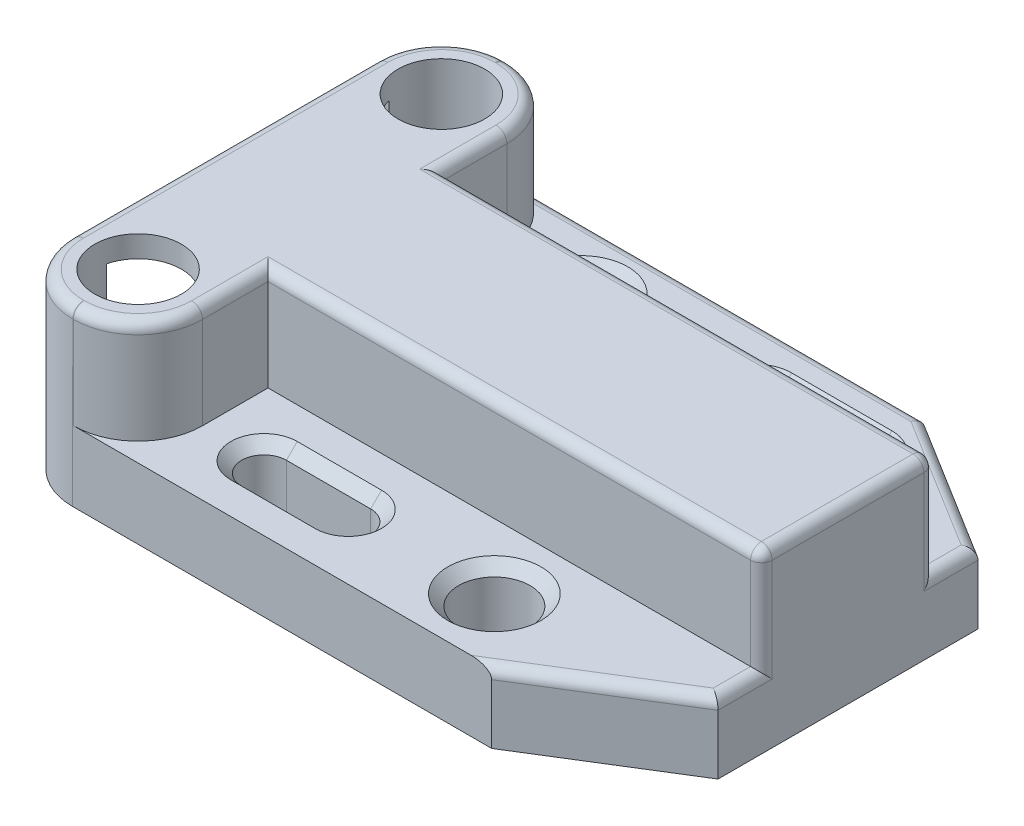
from build123d import *

# Parameters (mm, degrees)
BOSS_EXTRUDE1_DEPTH = 6.5
SKETCH2_R           = 4
CUT_EXTRUDE1_DEPTH  = 5.5
SKETCH2_3_R         = 4
BOSS_EXTRUDE2_DEPTH = 9.5
SKETCH3_R           = 3.3
CUT_EXTRUDE2_DEPTH  = 9.5
CHAMFER2_SIZE       = 1
FILLET4_R           = 1
FILLET11_R          = 1
SKETCH4_W           = 26.1
SKETCH4_H           = 12
CUT_EXTRUDE3_DEPTH  = 9.5
SKETCH6_W           = 14
SKETCH6_H           = 10
CUT_EXTRUDE4_DEPTH  = 20
SKETCH7_W           = 3
SKETCH7_H           = 1
CUT_EXTRUDE5_DEPTH  = 20


with BuildPart() as part:
    # Sketch1 → Boss-Extrude1 (new body)
    with BuildSketch(Plane(origin=(0, 0, 0), x_dir=(1, 0, 0), z_dir=(0, 1, 0))):
        with BuildLine():
            Line((33.105088062, -37.14381788), (46.001963062, -29.14381788))
            Line((46.001963062, -29.14381788), (46.001963062, -5.14381788))
            Line((46.001963062, -5.14381788), (33.105088062, 2.85618212))
            Line((33.105088062, 2.85618212), (-5.594911938, 2.85618212))
            ThreePointArc((-5.594911938, 2.85618212), (-9.802197286, 1.113467468), (-11.544911938, -3.09381788))
            Line((-11.544911938, -3.09381788), (-11.544911938, -31.19381788))
            ThreePointArc((-11.544911938, -31.19381788), (-9.802197286, -35.401103228), (-5.594911938, -37.14381788))
            Line((-5.594911938, -37.14381788), (33.105088062, -37.14381788))
        make_face()
    extrude(amount=BOSS_EXTRUDE1_DEPTH)

    # Sketch2 → Cut-Extrude1 (cut)
    with BuildSketch(Plane(origin=(0, 6.5, 0), x_dir=(1, 0, 0), z_dir=(0, 1, 0))):
        with Locations((-5.544911938, -3.14381788)):
            Circle(SKETCH2_R)
        with Locations((-5.544911938, -31.14381788)):
            Circle(SKETCH2_R)
    extrude(amount=-CUT_EXTRUDE1_DEPTH, mode=Mode.SUBTRACT)

    # Sketch2<3> → Boss-Extrude2 (add)
    with BuildSketch(Plane(origin=(0, 6.5, 0), x_dir=(1, 0, 0), z_dir=(0, 1, 0))):
        with BuildLine():
            Line((46.001963062, -25.14381788), (46.001963062, -9.14381788))
            Line((46.001963062, -9.14381788), (0.455088062, -9.14381788))
            Line((0.455088062, -9.14381788), (0.455088062, -3.09381788))
            ThreePointArc((0.455088062, -3.09381788), (-1.287626589, 1.113467468), (-5.494911938, 2.85618212))
            Line((-5.494911938, 2.85618212), (-5.594911938, 2.85618212))
            ThreePointArc((-5.594911938, 2.85618212), (-9.802197286, 1.113467468), (-11.544911938, -3.09381788))
            Line((-11.544911938, -3.09381788), (-11.544911938, -31.19381788))
            ThreePointArc((-11.544911938, -31.19381788), (-9.802197286, -35.401103228), (-5.594911938, -37.14381788))
            Line((-5.594911938, -37.14381788), (-5.494911938, -37.14381788))
            ThreePointArc((-5.494911938, -37.14381788), (-1.287626589, -35.401103228), (0.455088062, -31.19381788))
            Line((0.455088062, -31.19381788), (0.455088062, -25.14381788))
            Line((0.455088062, -25.14381788), (46.001963062, -25.14381788))
        make_face()
        with Locations((-5.544911938, -3.14381788)):
            Circle(SKETCH2_3_R, mode=Mode.SUBTRACT)
        with Locations((-5.544911938, -31.14381788)):
            Circle(SKETCH2_3_R, mode=Mode.SUBTRACT)
    extrude(amount=BOSS_EXTRUDE2_DEPTH)

    # Sketch3 → Cut-Extrude2 (cut)
    with BuildSketch(Plane(origin=(0, 6.5, 0), x_dir=(1, 0, 0), z_dir=(0, 1, 0))):
        with Locations((7.370661829, -3.14381788)):
            Circle(SKETCH3_R)
        with Locations((27.350367263, -31.143813967)):
            Circle(SKETCH3_R)
        with BuildLine():
            Line((6.084417868, -29.076203293), (13.8638938, -29.076203293))
            ThreePointArc((13.8638938, -29.076203293), (15.931492661, -31.143802154), (13.8638938, -33.211401015))
            Line((13.8638938, -33.211401015), (6.084417868, -33.211401015))
            ThreePointArc((6.084417868, -33.211401015), (4.016819007, -31.143802154), (6.084417868, -29.076203293))
        make_face()
        with BuildLine():
            Line((23.422260337, -0.771477607), (32.669870313, -0.771477607))
            ThreePointArc((32.669870313, -0.771477607), (35.042210586, -3.14381788), (32.669870313, -5.516158153))
            Line((32.669870313, -5.516158153), (23.422260337, -5.516158153))
            ThreePointArc((23.422260337, -5.516158153), (21.049920064, -3.14381788), (23.422260337, -0.771477607))
        make_face()
    extrude(amount=-CUT_EXTRUDE2_DEPTH, mode=Mode.SUBTRACT)

    # Chamfer2
    chamfer2_edges = [part.edges().sort_by_distance(p)[0] for p in [
        (4.070661829, 6.5, 3.14381788),
        (35.042210586, 6.5, 3.14381788),
        (28.046065325, 6.5, 0.771477607),
        (21.049920064, 6.5, 3.14381788),
        (28.046065325, 6.5, 5.516158153),
        (24.050367263, 6.5, 31.143813967),
        (9.974155834, 6.5, 33.211401015),
        (15.931492661, 6.5, 31.143802154),
        (4.016819007, 6.5, 31.143802154),
        (9.974155834, 6.5, 29.076203293),
    ]]
    chamfer(chamfer2_edges, length=CHAMFER2_SIZE)

    # Fillet4
    fillet4_edges = [part.edges().sort_by_distance(p)[0] for p in [
        (0.455088062, 16, 28.16881788),
        (-5.544911938, 16, -2.85618212),
        (-5.544911938, 16, 37.14381788),
        (46.001963062, 11.25, 25.14381788),
        (-1.287626589, 16, -1.113467468),
        (0.455088062, 16, 6.11881788),
        (23.228525562, 16, 25.14381788),
        (46.001963062, 11.25, 9.14381788),
        (46.001963062, 16, 17.14381788),
        (-11.544911938, 16, 17.14381788),
        (-9.802197286, 16, -1.113467468),
        (23.228525562, 16, 9.14381788),
        (-1.287626589, 16, 35.401103228),
        (-9.802197286, 16, 35.401103228),
        (46.001963062, 6.5, 7.14381788),
        (39.553525562, 6.5, 1.14381788),
        (13.805088062, 6.5, -2.85618212),
    ]]
    fillet(fillet4_edges, radius=FILLET4_R)

    # Fillet11
    fillet11_edges = [part.edges().sort_by_distance(p)[0] for p in [
        (39.553525562, 6.5, 33.14381788),
        (46.001963062, 6.5, 26.64381788),
    ]]
    fillet(fillet11_edges, radius=FILLET11_R)

    # Sketch4 → Cut-Extrude3 (cut)
    with BuildSketch(Plane.ZY.offset(11.544911938)):
        with Locations((17.14381788, 8)):
            Rectangle(SKETCH4_W, SKETCH4_H)
    extrude(amount=-CUT_EXTRUDE3_DEPTH, mode=Mode.SUBTRACT)

    # Sketch6 → Cut-Extrude4 (cut)
    with BuildSketch(Plane.ZY.offset(2.044911938)):
        with Locations((16.757961724, 8)):
            Rectangle(SKETCH6_W, SKETCH6_H)
    extrude(amount=-CUT_EXTRUDE4_DEPTH, mode=Mode.SUBTRACT)

    # Sketch7 → Cut-Extrude5 (cut)
    with BuildSketch(Plane.ZY.offset(2.044911938)):
        with Locations((16.757961724, 13.5)):
            Rectangle(SKETCH7_W, SKETCH7_H)
        with Locations((16.757961724, 2.5)):
            Rectangle(SKETCH7_W, SKETCH7_H)
    extrude(amount=-CUT_EXTRUDE5_DEPTH, mode=Mode.SUBTRACT)


solid = part.part
